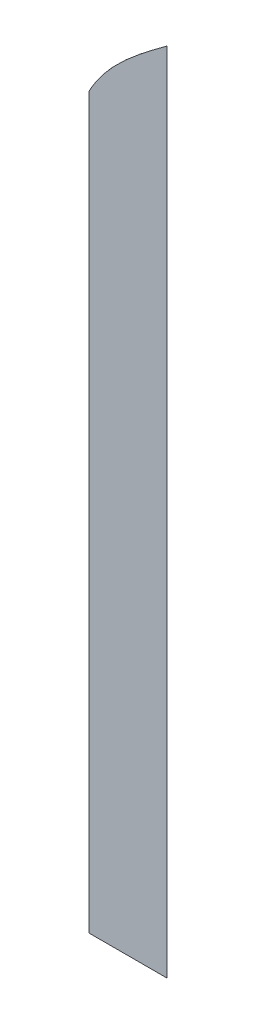
from build123d import *

# Parameters (mm, degrees)
BOSS_EXTRUDE1_DEPTH = 0.127
BOSS_EXTRUDE4_DEPTH = 0.127
SKETCH10_W          = 19.05
SKETCH10_H          = 1698.178342803
CUT_EXTRUDE1_DEPTH  = 1891.213262352


with BuildPart() as part:
    # Sketch1 → Boss-Extrude1 (new body)
    with BuildSketch(Plane.XY):
        with BuildLine():
            Line((0, 1651), (0, 0))
            Line((0, 0), (-723.9, 0))
            Line((-723.9, 0), (-709.936002969, 113.443804533))
            ThreePointArc((-709.936002969, 113.443804533), (-701.431945145, 146.014255937), (-684.669714613, 175.206394121))
            Line((-684.669714613, 175.206394121), (-443.570057255, 489.636807597))
            add(Edge.make_bspline(
                [(-443.570057255, 489.636807597), (-241.660374178, 752.957568109), (-282.743051657, 676.944413423), (0, 1651)],
                knots=[0, 0, 0, 0, 1, 1, 1, 1], degree=3))
        make_face()
    extrude(amount=BOSS_EXTRUDE1_DEPTH)


with BuildPart() as body_2:
    # Sketch9 → Boss-Extrude4 (new body)
    with BuildSketch(Plane.XY.offset(0.127)):
        with BuildLine():
            Line((200.025, 1879.6), (200.025, 0))
            Line((200.025, 0), (0, 0))
            Line((0, 0), (0, 1651))
            add(Edge.make_bspline(
                [(0, 1651), (31.180672882, 1758.41805479), (131.857515823, 1828.521058606), (200.025, 1879.6)],
                knots=[0, 0, 0, 0, 1, 1, 1, 1], degree=3))
        make_face()
    extrude(amount=-BOSS_EXTRUDE4_DEPTH)

    # Sketch10 → Cut-Extrude1 (cut, through all)
    with BuildSketch(Plane(origin=(0, 0, 0), x_dir=(-1, 0, 0), z_dir=(0, 0, -1))):
        with Locations((-9.525, 849.089171402)):
            Rectangle(SKETCH10_W, SKETCH10_H)
    extrude(amount=-CUT_EXTRUDE1_DEPTH, mode=Mode.SUBTRACT)


solid = body_2.part
